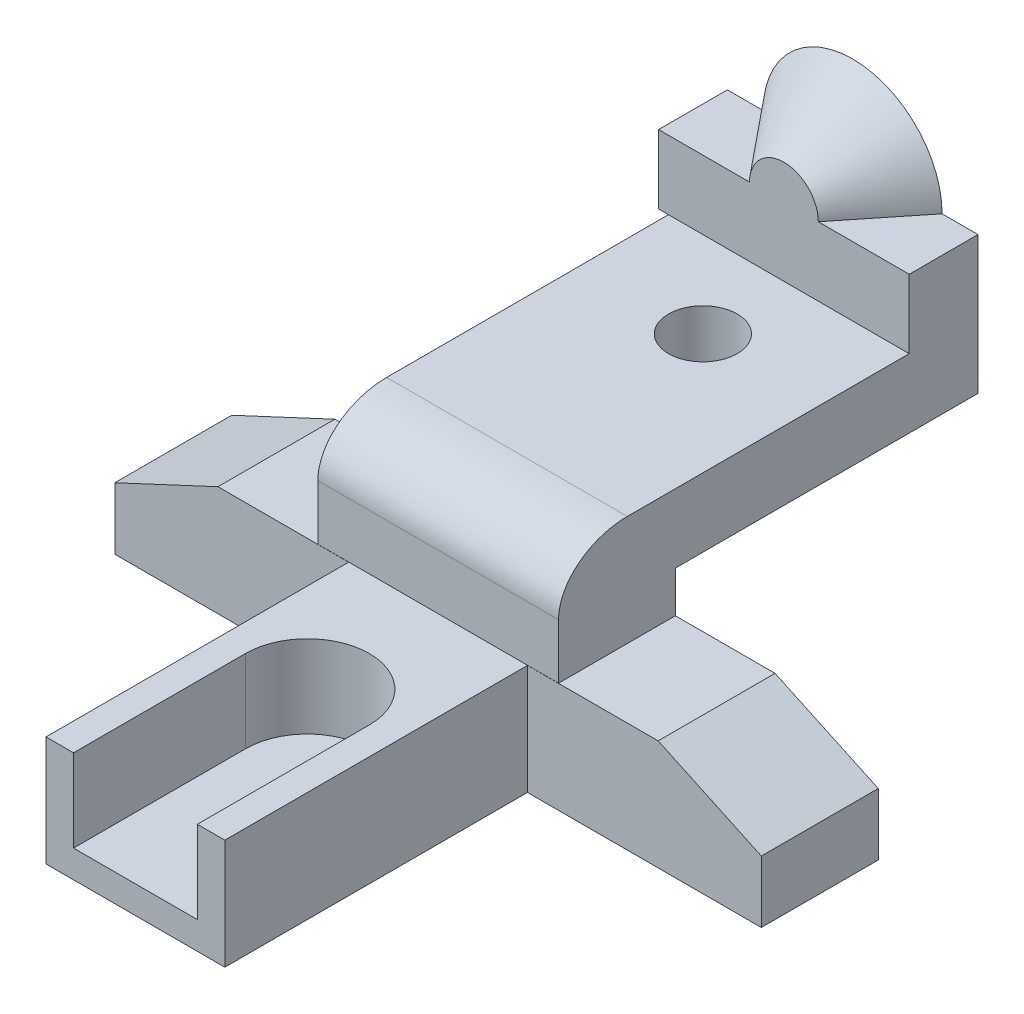
from build123d import *

# Parameters (mm, degrees)
BOSS_EXTRU_1_DEPTH      = 17
ESQUISSE2_W             = 26
ESQUISSE2_H             = 16
BOSS_EXTRU_2_DEPTH      = 44
ENL_V_MAT_EXTRU_1_DEPTH = 12
ESQUISSE4_W             = 35
ESQUISSE4_H             = 16.981352254
BOSS_EXTRU_3_DEPTH      = 16
ESQUISSE5_W             = 35
ESQUISSE5_H             = 10
BOSS_EXTRU_4_DEPTH      = 44
ESQUISSE6_W             = 36.437850792
ESQUISSE6_H             = 10
BOSS_EXTRU_5_DEPTH      = 10
CONG_1_SIZE             = 10
CONG_1_SIZE_2           = 8
ESQUISSE8_R             = 5
ENL_V_MAT_EXTRU_2_DEPTH = 10


with BuildPart() as part:
    # Esquisse1 → Boss.-Extru.1 (new body)
    with BuildSketch(Plane.XY):
        Polygon((0, 0), (94, 0), (94, 9), (79, 16), (15, 16), (0, 9), align=None)
    extrude(amount=-BOSS_EXTRU_1_DEPTH)

    # Esquisse2 → Boss.-Extru.2 (add)
    with BuildSketch(Plane.XY):
        with Locations((47, 8)):
            Rectangle(ESQUISSE2_W, ESQUISSE2_H)
    extrude(amount=BOSS_EXTRU_2_DEPTH)

    # Esquisse3 → Enlèv. mat.-Extru.1 (cut)
    with BuildSketch(Plane(origin=(0, 16, 0), x_dir=(1, 0, 0), z_dir=(0, 1, 0))):
        with BuildLine():
            Line((38, -44), (56, -44))
            Line((56, -44), (56, -19))
            ThreePointArc((56, -19), (47, -10), (38, -19))
            Line((38, -19), (38, -44))
        make_face()
    extrude(amount=-ENL_V_MAT_EXTRU_1_DEPTH, mode=Mode.SUBTRACT)

    # Esquisse4 → Boss.-Extru.3 (add)
    with BuildSketch(Plane(origin=(0, 16, 0), x_dir=(1, 0, 0), z_dir=(0, 1, 0))):
        with Locations((47, 8.509323873)):
            Rectangle(ESQUISSE4_W, ESQUISSE4_H)
    extrude(amount=BOSS_EXTRU_3_DEPTH)

    # Esquisse5 → Boss.-Extru.4 (add)
    with BuildSketch(Plane(origin=(0, 0, -17), x_dir=(-1, 0, 0), z_dir=(0, 0, -1))):
        with Locations((-47, 27)):
            Rectangle(ESQUISSE5_W, ESQUISSE5_H)
    extrude(amount=BOSS_EXTRU_4_DEPTH)

    # Esquisse6 → Boss.-Extru.5 (add)
    with BuildSketch(Plane(origin=(0, 32, 0), x_dir=(1, 0, 0), z_dir=(0, 1, 0))):
        with Locations((46.281074604, 56)):
            Rectangle(ESQUISSE6_W, ESQUISSE6_H)
    extrude(amount=BOSS_EXTRU_5_DEPTH)

    # Congé1
    # an asymmetric fillet: 10, 8 mm, written as the material it takes off along each edge
    with BuildSketch(Plane(origin=(4.5, 32, -0.018647746), x_dir=(0, 0, -1), z_dir=(1, 0, 0))) as cong_1_piece_1:
        with BuildLine():
            Bezier((CONG_1_SIZE, 0), (0, 0), (0, -CONG_1_SIZE_2), weights=[1, 0.707106781, 1])
            Line((0, -CONG_1_SIZE_2), (0, 0))
            Line((0, 0), (CONG_1_SIZE, 0))
        make_face()
    extrude(amount=85, mode=Mode.SUBTRACT)

    # Esquisse8 → Enlèv. mat.-Extru.2 (cut)
    with BuildSketch(Plane(origin=(0, 32, 0), x_dir=(1, 0, 0), z_dir=(0, 1, 0))):
        with Locations(Location((47, 38.5, 0), (0, 0, 180))):
            Circle(ESQUISSE8_R)
    extrude(amount=-ENL_V_MAT_EXTRU_2_DEPTH, mode=Mode.SUBTRACT)

    # Esquisse9 → Lissage2 section 0
    with BuildSketch(Plane.XY.offset(-51)):
        with BuildLine():
            Line((41.281074604, 42), (51.281074604, 42))
            ThreePointArc((51.281074604, 42), (46.281074604, 47), (41.281074604, 42))
        make_face()
    # Esquisse10 → Lissage2 section 1
    with BuildSketch(Plane(origin=(0, 0, -61), x_dir=(-1, 0, 0), z_dir=(0, 0, -1))):
        with BuildLine():
            Line((-33.281074604, 42), (-59.281074604, 42))
            ThreePointArc((-59.281074604, 42), (-46.281074604, 55), (-33.281074604, 42))
        make_face()
    loft()


solid = part.part
